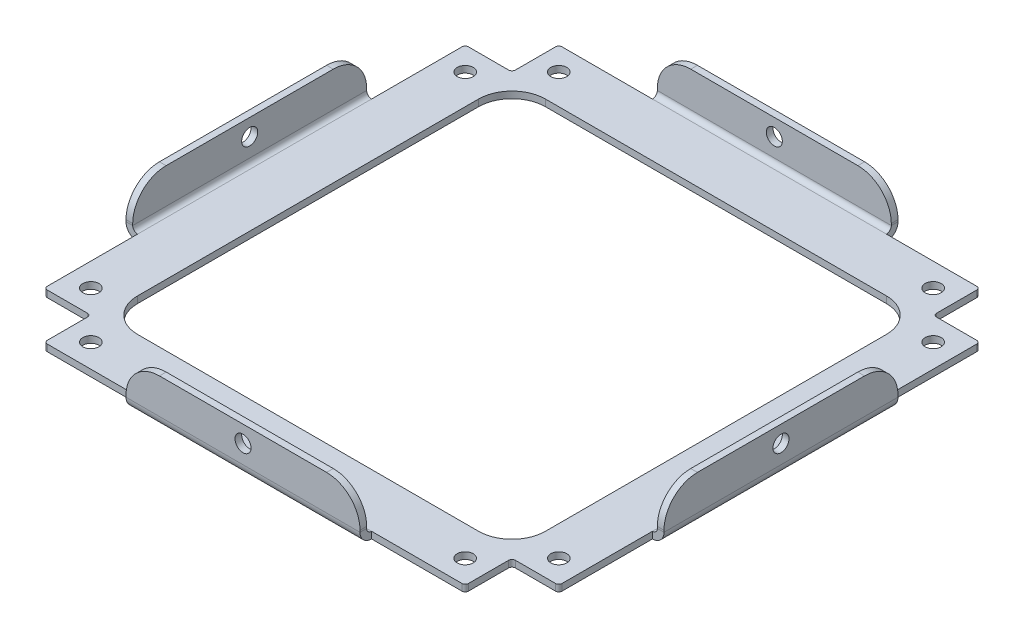
from build123d import *

# Parameters (mm, degrees)
SKETCH1_W          = 77
SKETCH1_H          = 77
BASE_FLANGE1_DEPTH = 1
EDGE_FLANGE1_DEPTH = 35
EDGE_FLANGE2_DEPTH = 35
EDGE_FLANGE3_DEPTH = 35
EDGE_FLANGE4_DEPTH = 35
CUT_EXTRUDE1_DEPTH = 58.218598018
FILLET1_R          = 0.5
FILLET2_R          = 5
M2_HOLE1_AA_D      = 2.4
M2_HOLE2_AB_D      = 2.4
M2_HOLE3_AC_D      = 2.4


# Sheet-metal steps are written as plain solids
with BuildPart() as part:
    # Sketch1 → Base-Flange1 (new body)
    with BuildSketch(Plane(origin=(0, 0, 0), x_dir=(1, 0, 0), z_dir=(0, 1, 0))):
        Rectangle(SKETCH1_W, SKETCH1_H)
    extrude(amount=-BASE_FLANGE1_DEPTH)

    # Edge-Flange1 section (across the edge) → Edge-Flange1 (add)
    with BuildSketch(Plane(origin=(-17.5, 0, 39.2366), x_dir=(0, 0, -1), z_dir=(1, 0, 0))):
        with BuildLine():
            Line((-1, 0.7366), (-1, 6))
            Line((-1, 6), (0, 6))
            Line((0, 6), (0, 0.7366))
            ThreePointArc((0, 0.7366), (0.215745145, 0.215745145), (0.7366, 0))
            Line((0.7366, 0), (0.7366, -1))
            ThreePointArc((0.7366, -1), (-0.491361636, -0.491361636), (-1, 0.7366))
        make_face()
    extrude(amount=EDGE_FLANGE1_DEPTH)

    # Edge-Flange2 section (across the edge) → Edge-Flange2 (add)
    with BuildSketch(Plane(origin=(17.5, 0, -39.2366), x_dir=(0, 0, 1), z_dir=(-1, 0, 0))):
        with BuildLine():
            Line((-1, 0.7366), (-1, 6))
            Line((-1, 6), (0, 6))
            Line((0, 6), (0, 0.7366))
            ThreePointArc((0, 0.7366), (0.215745145, 0.215745145), (0.7366, 0))
            Line((0.7366, 0), (0.7366, -1))
            ThreePointArc((0.7366, -1), (-0.491361636, -0.491361636), (-1, 0.7366))
        make_face()
    extrude(amount=EDGE_FLANGE2_DEPTH)

    # Edge-Flange3 section (across the edge) → Edge-Flange3 (add)
    with BuildSketch(Plane(origin=(-39.2366, 0, -17.5), x_dir=(1, 0, 0), z_dir=(0, 0, 1))):
        with BuildLine():
            Line((-1, 0.7366), (-1, 6))
            Line((-1, 6), (0, 6))
            Line((0, 6), (0, 0.7366))
            ThreePointArc((0, 0.7366), (0.215745145, 0.215745145), (0.7366, 0))
            Line((0.7366, 0), (0.7366, -1))
            ThreePointArc((0.7366, -1), (-0.491361636, -0.491361636), (-1, 0.7366))
        make_face()
    extrude(amount=EDGE_FLANGE3_DEPTH)

    # Edge-Flange4 section (across the edge) → Edge-Flange4 (add)
    with BuildSketch(Plane(origin=(39.2366, 0, 17.5), x_dir=(-1, 0, 0), z_dir=(0, 0, -1))):
        with BuildLine():
            Line((-1, 0.7366), (-1, 6))
            Line((-1, 6), (0, 6))
            Line((0, 6), (0, 0.7366))
            ThreePointArc((0, 0.7366), (0.215745145, 0.215745145), (0.7366, 0))
            Line((0.7366, 0), (0.7366, -1))
            ThreePointArc((0.7366, -1), (-0.491361636, -0.491361636), (-1, 0.7366))
        make_face()
    extrude(amount=EDGE_FLANGE4_DEPTH)

    # Sketch18 → Cut-Extrude1 (cut, through all)
    with BuildSketch(Plane(origin=(0, 0, 0), x_dir=(1, 0, 0), z_dir=(0, 1, 0))):
        with BuildLine():
            Line((-25.5, -30.5), (25.5, -30.5))
            ThreePointArc((25.5, -30.5), (29.035533906, -29.035533906), (30.5, -25.5))
            Line((30.5, -25.5), (30.5, 25.5))
            ThreePointArc((30.5, 25.5), (29.035533906, 29.035533906), (25.5, 30.5))
            Line((25.5, 30.5), (-25.5, 30.5))
            ThreePointArc((-25.5, 30.5), (-29.035533906, 29.035533906), (-30.5, 25.5))
            Line((-30.5, 25.5), (-30.5, -25.5))
            ThreePointArc((-30.5, -25.5), (-29.035533906, -29.035533906), (-25.5, -30.5))
        make_face()
        with BuildLine():
            Line((-38.5, 38.5), (-31.5, 38.5))
            Line((-31.5, 38.5), (-31.5, 32))
            ThreePointArc((-31.5, 32), (-31.646446609, 31.646446609), (-32, 31.5))
            Line((-32, 31.5), (-38.5, 31.5))
            Line((-38.5, 31.5), (-38.5, 38.5))
        make_face()
        with BuildLine():
            Line((38.5, 38.5), (31.5, 38.5))
            Line((31.5, 38.5), (31.5, 32))
            ThreePointArc((31.5, 32), (31.646446609, 31.646446609), (32, 31.5))
            Line((32, 31.5), (38.5, 31.5))
            Line((38.5, 31.5), (38.5, 38.5))
        make_face()
        with BuildLine():
            Line((38.5, -38.5), (31.5, -38.5))
            Line((31.5, -38.5), (31.5, -32))
            ThreePointArc((31.5, -32), (31.646446609, -31.646446609), (32, -31.5))
            Line((32, -31.5), (38.5, -31.5))
            Line((38.5, -31.5), (38.5, -38.5))
        make_face()
        with BuildLine():
            Line((-38.5, -38.5), (-31.5, -38.5))
            Line((-31.5, -38.5), (-31.5, -32))
            ThreePointArc((-31.5, -32), (-31.646446609, -31.646446609), (-32, -31.5))
            Line((-32, -31.5), (-38.5, -31.5))
            Line((-38.5, -31.5), (-38.5, -38.5))
        make_face()
    extrude(amount=-CUT_EXTRUDE1_DEPTH, mode=Mode.SUBTRACT)

    # Fillet1
    fillet1_edges = [part.edges().sort_by_distance(p)[0] for p in [
        (31.5, -0.5, -38.5),
        (38.5, -0.5, -31.5),
        (38.5, -0.5, 31.5),
        (31.5, -0.5, 38.5),
        (-31.5, -0.5, 38.5),
        (-38.5, -0.5, 31.5),
        (-38.5, -0.5, -31.5),
        (-31.5, -0.5, -38.5),
    ]]
    fillet(fillet1_edges, radius=FILLET1_R)

    # Fillet2
    fillet2_edges = [part.edges().sort_by_distance(p)[0] for p in [
        (39.7366, 6, 17.5),
        (39.7366, 6, -17.5),
        (-17.5, 6, 39.7366),
        (17.5, 6, 39.7366),
        (17.5, 6, -39.7366),
        (-17.5, 6, -39.7366),
        (-39.7366, 6, -17.5),
        (-39.7366, 6, 17.5),
    ]]
    fillet(fillet2_edges, radius=FILLET2_R)

    # M2 Hole1 - AA (through all)
    with Locations(Plane(origin=(-35, 0, -28), x_dir=(0, 0, 1), z_dir=(0, 1, 0))):
        with Locations((0, 0), (-7, 7), (-7, 63), (0, 70), (56, 0), (63, 7), (63, 63), (56, 70)):
            Hole(M2_HOLE1_AA_D / 2)

    # M2 Hole2 - AB (through all)
    with Locations(Plane.ZY.offset(40.2366)):
        with Locations((0, 3.5)):
            Hole(M2_HOLE2_AB_D / 2)

    # M2 Hole3 - AC (through all)
    with Locations(Plane.XY.offset(40.2366)):
        with Locations((0, 3.5)):
            Hole(M2_HOLE3_AC_D / 2)


solid = part.part
